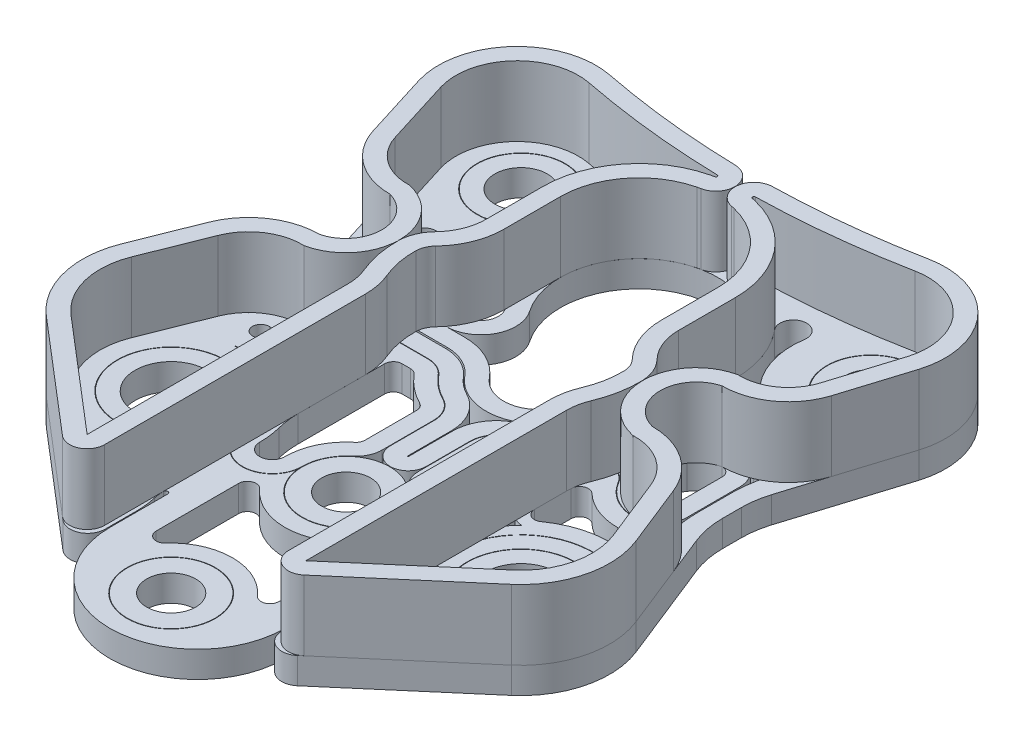
from build123d import *

# Parameters (mm, degrees)
BOSS_EXTRUDE1_START       = -3
BOSS_EXTRUDE1_OUTLINE_R   = 4.125000012
BOSS_EXTRUDE1_OUTLINE_R_2 = 2.799999992
BOSS_EXTRUDE1_OUTLINE_R_3 = 2.8
BOSS_EXTRUDE1_OUTLINE_R_4 = 4.124999994
BOSS_EXTRUDE1_OUTLINE_R_5 = 2.999999995
BOSS_EXTRUDE1_OUTLINE_R_6 = 3.000000008
BOSS_EXTRUDE1_DEPTH       = 3
EXTRUDE_THIN1_DEPTH       = 8
CUT_EXTRUDE_THIN1_START   = -3
SKETCH5_R                 = 5.049999995
SKETCH5_R_2               = 4.999999995
SKETCH5_R_3               = 5.050000008
SKETCH5_R_4               = 5.000000008
SKETCH5_R_5               = 5.050000041
SKETCH5_R_6               = 5.000000041
SKETCH5_R_7               = 6.175000012
SKETCH5_R_8               = 6.125000012
SKETCH5_R_9               = 6.174999994
SKETCH5_R_10              = 6.124999994
SKETCH5_R_11              = 5.049999983
SKETCH5_R_12              = 4.999999983
CUT_EXTRUDE_THIN1_DEPTH   = 3


# Read off the part's stored shape, not the designer's step: Boss-Extrude1
with BuildPart() as part:
    # Boss-Extrude1 outline → Boss-Extrude1 (new body)
    with BuildSketch(Plane(origin=(0, 0, 0), x_dir=(1, 0, 0), z_dir=(0, 1, 0)).offset(BOSS_EXTRUDE1_START)):
        with BuildLine():
            ThreePointArc((10.366684408, -31.537922105), (10.166894835, -32.677211872), (10.099999983, -33.831950857))
            Line((10.099999983, -33.831950857), (10.099999983, -37.450766092))
            ThreePointArc((10.099999983, -37.450766092), (11.263415045, -39.267390886), (13.400125624, -38.970527033))
            Line((13.400125624, -38.970527033), (26.581886043, -27.693789811))
            ThreePointArc((26.581886043, -27.693789811), (29.830051345, -22.426049379), (29.405725776, -16.251940949))
            Line((29.405725776, -16.251940949), (24.835394347, -4.782729295))
            ThreePointArc((24.835394347, -4.782729295), (24.304204333, -2.965609917), (24.12500005, -1.080942443))
            Line((24.12500005, -1.080942443), (24.12500005, 1.080943044))
            ThreePointArc((24.12500005, 1.080943044), (24.23905788, 2.586980033), (24.578629532, 4.058661959))
            Line((24.578629532, 4.058661959), (28.591733397, 16.924408361))
            ThreePointArc((28.591733397, 16.924408361), (26.651472545, 25.57149452), (18.240710019, 28.363587809))
            ThreePointArc((18.240710019, 28.363587809), (-9.2e-08, 26.5863268), (-18.240710204, 28.363587806))
            ThreePointArc((-18.240710204, 28.363587806), (-26.651472682, 25.571494548), (-28.591733597, 16.92440846))
            Line((-28.591733597, 16.92440846), (-24.578629568, 4.058661534))
            ThreePointArc((-24.578629568, 4.058661534), (-24.239057916, 2.586979607), (-24.125000086, 1.080942618))
            Line((-24.125000086, 1.080942618), (-24.125000086, -1.0809423))
            ThreePointArc((-24.125000086, -1.0809423), (-24.304204369, -2.965609774), (-24.835394384, -4.782729151))
            Line((-24.835394384, -4.782729151), (-29.405725836, -16.251940865))
            ThreePointArc((-29.405725836, -16.251940865), (-29.830051411, -22.42604931), (-26.581886114, -27.693789764))
            Line((-26.581886114, -27.693789764), (-13.400125663, -38.970526985))
            ThreePointArc((-13.400125663, -38.970526985), (-11.263415083, -39.267390839), (-10.100000021, -37.450766045))
            Line((-10.100000021, -37.450766045), (-10.100000021, -33.83195081))
            ThreePointArc((-10.100000021, -33.83195081), (-10.166894873, -32.677211824), (-10.366684446, -31.537922057))
            ThreePointArc((-10.366684446, -31.537922057), (-10.46759199, -30.95949776), (-10.499995417, -30.373232446))
            ThreePointArc((-10.499995417, -30.373232446), (-10.249556618, -30.124118114), (-10.000000021, -30.374116208))
            Line((-10.000000021, -30.374116208), (-10.000000021, -36.999999964))
            ThreePointArc((-10.000000021, -36.999999964), (-3.6e-08, -46.99999995), (9.99999995, -36.999999964))
            Line((9.99999995, -36.999999964), (9.99999995, -30.374999964))
            ThreePointArc((9.99999995, -30.374999964), (10.249116215, -30.125001526), (10.499993702, -30.373232505))
            ThreePointArc((10.499993702, -30.373232505), (10.467591952, -30.959497807), (10.366684408, -31.537922105))
        make_face()
        with BuildLine():
            Line((-12.500000027, -29.028587579), (-12.49998292, -30.366162352))
            ThreePointArc((-12.49998292, -30.366162352), (-12.454618123, -31.186933792), (-12.313347561, -31.996727808))
            ThreePointArc((-12.313347561, -31.996727808), (-12.153515903, -32.908159621), (-12.100000021, -33.83195081))
            Line((-12.100000021, -33.83195081), (-12.100000021, -37.450766045))
            Line((-12.100000021, -37.450766045), (-18.789338812, -31.728167974))
            ThreePointArc((-18.789338812, -31.728167974), (-19.103097358, -30.701738615), (-18.306532065, -29.982374043))
            ThreePointArc((-18.306532065, -29.982374043), (-16.09435347, -29.341389079), (-14.084269695, -28.217040787))
            ThreePointArc((-14.084269695, -28.217040787), (-13.044083394, -28.138577883), (-12.500000027, -29.028587579))
        make_face(mode=Mode.SUBTRACT)
        with Locations((-19.999999947, -20.000000079)):
            Circle(BOSS_EXTRUDE1_OUTLINE_R, mode=Mode.SUBTRACT)
        with BuildLine():
            Line((-11.800000029, -12.520592954), (-11.800000029, -15.023492615))
            ThreePointArc((-11.800000029, -15.023492615), (-11.799396788, -15.140252604), (-11.797587127, -15.257000126))
            ThreePointArc((-11.797587127, -15.257000126), (-12.499913264, -14.209980688), (-13.3350313, -13.265475752))
            ThreePointArc((-13.3350313, -13.265475752), (-12.495888638, -13.040641099), (-11.800000029, -12.520592954))
        make_face(mode=Mode.SUBTRACT)
        with BuildLine():
            ThreePointArc((-7.00000006, -20.000000014), (-8.43750006, -21.437500014), (-9.87500006, -20.000000014))
            ThreePointArc((-9.87500006, -20.000000014), (-9.953917866, -18.738311642), (-10.189441058, -17.496291354))
            ThreePointArc((-10.189441058, -17.496291354), (-10.422056562, -16.269604649), (-10.50000008, -15.023492674))
            Line((-10.50000008, -15.023492674), (-10.50000008, -5.100000013))
            ThreePointArc((-10.50000008, -5.100000013), (-10.207106861, -4.392893232), (-9.50000008, -4.100000013))
            Line((-9.50000008, -4.100000013), (-8.532291675, -4.100000013))
            ThreePointArc((-8.532291675, -4.100000013), (-8.107815311, -4.194560995), (-7.76361675, -4.460360381))
            ThreePointArc((-7.76361675, -4.460360381), (-6.307869008, -5.888015556), (-4.595045106, -6.994195952))
            ThreePointArc((-4.595045106, -6.994195952), (-4.197077158, -7.362673506), (-4.050000061, -7.884710404))
            Line((-4.050000061, -7.884710404), (-4.050000061, -13.795364615))
            ThreePointArc((-4.050000061, -13.795364615), (-4.146880469, -14.224753728), (-4.418750069, -14.570944058))
            ThreePointArc((-4.418750069, -14.570944058), (-6.321837217, -16.994276304), (-7.00000006, -20.000000014))
        make_face(mode=Mode.SUBTRACT)
        with Locations((-1.9e-08, -40.000000014)):
            Circle(BOSS_EXTRUDE1_OUTLINE_R_2, mode=Mode.SUBTRACT)
        with BuildLine():
            ThreePointArc((-5.250000011, -35.36993534), (-6.353553404, -35.64391187), (-7.000000019, -34.708497521))
            Line((-7.000000019, -34.708497521), (-7.000000019, -25.291502636))
            ThreePointArc((-7.000000019, -25.291502636), (-6.35355341, -24.356088289), (-5.250000019, -24.630064808))
            ThreePointArc((-5.250000019, -24.630064808), (-1.9e-08, -27.000000014), (5.249999981, -24.630064808))
            ThreePointArc((5.249999981, -24.630064808), (6.353553372, -24.356088289), (6.999999981, -25.291502636))
            Line((6.999999981, -25.291502636), (6.999999981, -34.708497521))
            ThreePointArc((6.999999981, -34.708497521), (6.353553366, -35.64391187), (5.249999973, -35.36993534))
            ThreePointArc((5.249999973, -35.36993534), (-1.9e-08, -33.0000001), (-5.250000011, -35.36993534))
        make_face(mode=Mode.SUBTRACT)
        with BuildLine():
            ThreePointArc((12.099999983, -33.831950857), (12.153515865, -32.908159669), (12.313347523, -31.996727855))
            ThreePointArc((12.313347523, -31.996727855), (12.454618084, -31.186933839), (12.499982882, -30.3661624))
            Line((12.499982882, -30.3661624), (12.499999988, -29.028587627))
            ThreePointArc((12.499999988, -29.028587627), (13.044083355, -28.13857793), (14.084269657, -28.217040834))
            ThreePointArc((14.084269657, -28.217040834), (16.094353431, -29.341389127), (18.306532027, -29.982374091))
            ThreePointArc((18.306532027, -29.982374091), (19.103097319, -30.701738663), (18.789338773, -31.728168021))
            Line((18.789338773, -31.728168021), (12.099999983, -37.450766092))
            Line((12.099999983, -37.450766092), (12.099999983, -33.831950857))
        make_face(mode=Mode.SUBTRACT)
        with Locations((0, -20.000000023)):
            Circle(BOSS_EXTRUDE1_OUTLINE_R_3, mode=Mode.SUBTRACT)
        with BuildLine():
            ThreePointArc((9.499999921, -4.099999975), (10.207106843, -4.392893112), (10.500000143, -5.099999967))
            Line((10.500000143, -5.099999967), (10.500000143, -15.023492628))
            ThreePointArc((10.500000143, -15.023492628), (10.422056621, -16.269604679), (10.189441095, -17.496291457))
            ThreePointArc((10.189441095, -17.496291457), (9.953917913, -18.738311703), (9.875000106, -20.000000032))
            ThreePointArc((9.875000106, -20.000000032), (8.437500055, -21.437500065), (7.000000022, -20.000000014))
            ThreePointArc((7.000000022, -20.000000014), (6.321837176, -16.994276299), (4.418750023, -14.570944051))
            ThreePointArc((4.418750023, -14.570944051), (4.146880421, -14.224753718), (4.050000013, -13.795364601))
            Line((4.050000013, -13.795364601), (4.050000013, -7.88471046))
            ThreePointArc((4.050000013, -7.88471046), (4.197077085, -7.362673564), (4.595045014, -6.994196002))
            ThreePointArc((4.595045014, -6.994196002), (6.307868914, -5.888015584), (7.763616651, -4.460360389))
            ThreePointArc((7.763616651, -4.460360389), (8.10781518, -4.194560993), (8.532291516, -4.099999975))
            Line((8.532291516, -4.099999975), (9.499999921, -4.099999975))
        make_face(mode=Mode.SUBTRACT)
        with BuildLine():
            Line((11.800000091, -15.023492674), (11.800000091, -12.520593014))
            ThreePointArc((11.800000091, -12.520593014), (12.495888699, -13.040641158), (13.335031361, -13.265475811))
            ThreePointArc((13.335031361, -13.265475811), (12.499913326, -14.209980747), (11.797587189, -15.257000186))
            ThreePointArc((11.797587189, -15.257000186), (11.799396849, -15.140252663), (11.800000091, -15.023492674))
        make_face(mode=Mode.SUBTRACT)
        with Locations((20.00000005, -20.000000079)):
            Circle(BOSS_EXTRUDE1_OUTLINE_R_4, mode=Mode.SUBTRACT)
        with BuildLine():
            ThreePointArc((-12.50000008, -10.971399629), (-13.044077752, -11.861419197), (-14.084269742, -11.782959215))
            ThreePointArc((-14.084269742, -11.782959215), (-17.244176451, -10.257255999), (-20.735075162, -9.901718511))
            ThreePointArc((-20.735075162, -9.901718511), (-21.757665264, -8.950859274), (-20.735075162, -8.000000038))
            Line((-20.735075162, -8.000000038), (-19.000000077, -8.000000038))
            ThreePointArc((-19.000000077, -8.000000038), (-16.409926191, -7.503192906), (-14.187500073, -6.083290721))
            ThreePointArc((-14.187500073, -6.083290721), (-13.104715368, -5.890916454), (-12.50000008, -6.809475106))
            Line((-12.50000008, -6.809475106), (-12.50000008, -10.971399629))
        make_face(mode=Mode.SUBTRACT)
        with BuildLine():
            Line((21.999999873, -3.000000013), (21.999999873, 3.000000012))
            ThreePointArc((21.999999873, 3.000000012), (21.121320259, 5.121320355), (18.99999995, 6.000000051))
            Line((18.99999995, 6.000000051), (20.570425502, 6.000000051))
            ThreePointArc((20.570425502, 6.000000051), (22.348071521, 6.583396407), (23.43433614, 8.106684252))
            Line((23.43433614, 8.106684252), (22.669354954, 5.654205029))
            ThreePointArc((22.669354954, 5.654205029), (22.261869098, 3.888186745), (22.124999815, 2.080942406))
            Line((22.124999815, 2.080942406), (22.124999815, -2.080942362))
            ThreePointArc((22.124999815, -2.080942362), (22.261869216, -3.8881868), (22.669355214, -5.654205161))
            Line((22.669355214, -5.654205161), (23.434336298, -8.106684057))
            ThreePointArc((23.434336298, -8.106684057), (22.561253849, -6.755762436), (21.115860751, -6.049999739))
            Line((21.115860751, -6.049999739), (18.999999597, -6.049999739))
            ThreePointArc((18.999999597, -6.049999739), (16.514516956, -5.396006561), (14.672792221, -3.603415968))
            ThreePointArc((14.672792221, -3.603415968), (13.578698307, -2.538510654), (12.102173951, -2.149999851))
            Line((12.102173951, -2.149999851), (8.532291319, -2.149999851))
            ThreePointArc((8.532291319, -2.149999851), (7.280086054, -2.428954742), (6.264700303, -3.213062919))
            ThreePointArc((6.264700303, -3.213062919), (5.090012795, -4.365081699), (3.707882645, -5.257692621))
            ThreePointArc((3.707882645, -5.257692621), (2.533877342, -6.344701531), (2.100000079, -7.884710409))
            Line((2.100000079, -7.884710409), (2.100000079, -13.795364585))
            ThreePointArc((2.100000079, -13.795364585), (2.385797275, -15.062062439), (3.187812582, -16.083323884))
            ThreePointArc((3.187812582, -16.083323884), (4.560754043, -17.831585028), (5.050000103, -20.000000019))
            ThreePointArc((5.050000103, -20.000000019), (8.437500057, -23.387499984), (11.825000025, -20.000000032))
            ThreePointArc((11.825000025, -20.000000032), (14.514181795, -13.938942129), (20.812504167, -11.865477201))
            ThreePointArc((20.812504167, -11.865477201), (20.834895662, -11.89283814), (20.807534723, -11.915229634))
            ThreePointArc((20.807534723, -11.915229634), (14.547734201, -13.976012819), (11.875000025, -20.000000032))
            ThreePointArc((11.875000025, -20.000000032), (8.437500057, -23.437499984), (5.000000103, -20.000000019))
            ThreePointArc((5.000000103, -20.000000019), (0, -14.99999992), (-5.000000103, -20.000000019))
            ThreePointArc((-5.000000103, -20.000000019), (-8.437500103, -23.43750001), (-11.875000103, -20.000000019))
            ThreePointArc((-11.875000103, -20.000000019), (-14.547734248, -13.976012803), (-20.807534758, -11.915229612))
            ThreePointArc((-20.807534758, -11.915229612), (-20.834895697, -11.892838118), (-20.812504202, -11.865477179))
            ThreePointArc((-20.812504202, -11.865477179), (-14.514181843, -13.938942113), (-11.825000103, -20.000000019))
            ThreePointArc((-11.825000103, -20.000000019), (-8.437500103, -23.38750001), (-5.050000103, -20.000000019))
            ThreePointArc((-5.050000103, -20.000000019), (-4.560754043, -17.831585028), (-3.187812582, -16.083323884))
            ThreePointArc((-3.187812582, -16.083323884), (-2.385797278, -15.062062431), (-2.100000084, -13.795364572))
            Line((-2.100000084, -13.795364572), (-2.100000084, -7.884710396))
            ThreePointArc((-2.100000084, -7.884710396), (-2.533877515, -6.344701559), (-3.707882945, -5.257692775))
            ThreePointArc((-3.707882945, -5.257692775), (-5.090013121, -4.365081919), (-6.26470067, -3.2130632))
            ThreePointArc((-6.26470067, -3.2130632), (-7.280086411, -2.42895501), (-8.532291672, -2.150000103))
            Line((-8.532291672, -2.150000103), (-12.102174341, -2.150000103))
            ThreePointArc((-12.102174341, -2.150000103), (-13.578698698, -2.538510906), (-14.672792612, -3.60341622))
            ThreePointArc((-14.672792612, -3.60341622), (-16.514517397, -5.396006848), (-19.000000102, -6.050000019))
            Line((-19.000000102, -6.050000019), (-21.115861256, -6.050000019))
            ThreePointArc((-21.115861256, -6.050000019), (-22.561254363, -6.755762697), (-23.434336829, -8.106684307))
            Line((-23.434336829, -8.106684307), (-22.669355612, -5.654205094))
            ThreePointArc((-22.669355612, -5.654205094), (-22.261869602, -3.888186778), (-22.125000181, -2.080942384))
            Line((-22.125000181, -2.080942384), (-22.125000181, 2.080942384))
            ThreePointArc((-22.125000181, 2.080942384), (-22.261869579, 3.88818678), (-22.669355568, 5.654205101))
            Line((-22.669355568, 5.654205101), (-23.434336754, 8.106684324))
            ThreePointArc((-23.434336754, 8.106684324), (-22.348071931, 6.58339629), (-20.570425601, 6.000000006))
            Line((-20.570425601, 6.000000006), (-19.00000004, 6.000000006))
            ThreePointArc((-19.00000004, 6.000000006), (-21.121320345, 5.121320333), (-21.999999982, 3.000000013))
            Line((-21.999999982, 3.000000013), (-21.999999982, -3.000000013))
            ThreePointArc((-21.999999982, -3.000000013), (-21.121320317, -5.121320376), (-18.999999953, -6.000000041))
            ThreePointArc((-18.999999953, -6.000000041), (-16.531447812, -5.348131817), (-14.706563884, -3.562500017))
            ThreePointArc((-14.706563884, -3.562500017), (-13.611633534, -2.491120942), (-12.130502206, -2.10000001))
            Line((-12.130502206, -2.10000001), (-8.532291669, -2.10000001))
            ThreePointArc((-8.532291669, -2.10000001), (-7.258862586, -2.38368295), (-6.226266907, -3.181081097))
            ThreePointArc((-6.226266907, -3.181081097), (-5.058786071, -4.326032277), (-3.685135246, -5.213167059))
            ThreePointArc((-3.685135246, -5.213167059), (-2.49123142, -6.31859972), (-2.050000134, -7.884710402))
            Line((-2.050000134, -7.884710402), (-2.050000134, -12.89999997))
            ThreePointArc((-2.050000134, -12.89999997), (-4.9e-08, -14.950000054), (2.050000035, -12.89999997))
            Line((2.050000035, -12.89999997), (2.050000035, -7.884710402))
            ThreePointArc((2.050000035, -7.884710402), (2.491231321, -6.31859972), (3.685135147, -5.213167059))
            ThreePointArc((3.685135147, -5.213167059), (5.058785972, -4.326032277), (6.226266808, -3.181081097))
            ThreePointArc((6.226266808, -3.181081097), (7.258862478, -2.383682962), (8.532291547, -2.100000023))
            Line((8.532291547, -2.100000023), (12.13050177, -2.100000023))
            ThreePointArc((12.13050177, -2.100000023), (13.611633064, -2.491120937), (14.706563409, -3.562499965))
            ThreePointArc((14.706563409, -3.562499965), (16.531447522, -5.348131816), (18.999999949, -5.999999936))
            ThreePointArc((18.999999949, -5.999999936), (21.121320239, -5.121320302), (21.999999873, -3.000000013))
        make_face(mode=Mode.SUBTRACT)
        with BuildLine():
            Line((8.566796286, 0.100000019), (12.130501728, 0.100000019))
            ThreePointArc((12.130501728, 0.100000019), (14.599053919, 0.751868227), (16.423937833, 2.537499986))
            ThreePointArc((16.423937833, 2.537499986), (17.518868376, 3.60887917), (18.999999946, 4.000000022))
            ThreePointArc((18.999999946, 4.000000022), (19.707106659, 3.70710679), (19.999999844, 3.000000057))
            Line((19.999999844, 3.000000057), (19.999999844, -3.000000013))
            ThreePointArc((19.999999844, -3.000000013), (19.707106656, -3.70710672), (18.999999949, -3.999999908))
            ThreePointArc((18.999999949, -3.999999908), (17.518868396, -3.608879064), (16.423937856, -2.537499904))
            ThreePointArc((16.423937856, -2.537499904), (14.599053947, -0.751868183), (12.130501783, -0.099999991))
            Line((12.130501783, -0.099999991), (8.532291616, -0.099999991))
            ThreePointArc((8.532291616, -0.099999991), (6.409909791, -0.572804904), (4.688916986, -1.901801842))
            ThreePointArc((4.688916986, -1.901801842), (3.809703006, -2.764049037), (2.775225204, -3.432138196))
            ThreePointArc((2.775225204, -3.432138196), (0.785385492, -5.274525956), (0.050000019, -7.884710422))
            Line((0.050000019, -7.884710422), (0.050000019, -12.899999966))
            ThreePointArc((0.050000019, -12.899999966), (-3.4e-08, -12.950000019), (-0.050000087, -12.899999966))
            Line((-0.050000087, -12.899999966), (-0.050000087, -7.884710422))
            ThreePointArc((-0.050000087, -7.884710422), (-0.785385575, -5.274525933), (-2.775225313, -3.432138162))
            ThreePointArc((-2.775225313, -3.432138162), (-3.809703095, -2.764049), (-4.688917057, -1.901801808))
            ThreePointArc((-4.688917057, -1.901801808), (-6.409909853, -0.572804904), (-8.532291653, -0.100000006))
            Line((-8.532291653, -0.100000006), (-12.130502211, -0.100000006))
            ThreePointArc((-12.130502211, -0.100000006), (-14.599054423, -0.751868227), (-16.423938341, -2.537500017))
            ThreePointArc((-16.423938341, -2.537500017), (-17.5188687, -3.6088791), (-19.000000039, -4.000000035))
            ThreePointArc((-19.000000039, -4.000000035), (-19.70710675, -3.70710681), (-19.999999975, -3.000000013))
            Line((-19.999999975, -3.000000013), (-19.999999975, 2.999999987))
            ThreePointArc((-19.999999975, 2.999999987), (-19.70710677, 3.707106768), (-19, 4))
            ThreePointArc((-19, 4), (-17.518868692, 3.608879058), (-16.423938353, 2.537499996))
            ThreePointArc((-16.423938353, 2.537499996), (-14.599054437, 0.75186822), (-12.130502235, 0.100000006))
            Line((-12.130502235, 0.100000006), (-8.566796426, 0.100000006))
            ThreePointArc((-8.566796426, 0.100000006), (-6.408303686, -0.389910295), (-4.672798077, -1.763636357))
            ThreePointArc((-4.672798077, -1.763636357), (-5.8e-08, -3.999999994), (4.67279796, -1.763636357))
            ThreePointArc((4.67279796, -1.763636357), (6.408303557, -0.389910293), (8.566796286, 0.100000019))
        make_face(mode=Mode.SUBTRACT)
        with BuildLine():
            ThreePointArc((-11.096097269, 21.311684072), (-9.184986877, 22.990779132), (-8.43497969, 20.559896089))
            ThreePointArc((-8.43497969, 20.559896089), (-10.988510456, 14.001996274), (-9.044328648, 7.238363637))
            ThreePointArc((-9.044328648, 7.238363637), (-8.917209306, 5.171756308), (-10.68875203, 4.100000013))
            Line((-10.68875203, 4.100000013), (-11.58447578, 4.100000013))
            ThreePointArc((-11.58447578, 4.100000013), (-12.515425114, 4.329877605), (-13.232370056, 4.966666675))
            ThreePointArc((-13.232370056, 4.966666675), (-15.741677392, 7.195428442), (-19.000000108, 8.000000003))
            Line((-19.000000108, 8.000000003), (-20.570425657, 8.000000003))
            ThreePointArc((-20.570425657, 8.000000003), (-22.178350476, 9.509047598), (-20.570425657, 11.018095192))
            ThreePointArc((-20.570425657, 11.018095192), (-13.377975934, 13.905018789), (-11.096097269, 21.311684072))
        make_face(mode=Mode.SUBTRACT)
        with Locations((-19.999999947, 19.999999965)):
            Circle(BOSS_EXTRUDE1_OUTLINE_R_5, mode=Mode.SUBTRACT)
        with BuildLine():
            ThreePointArc((14.084269761, -11.782959248), (13.044077764, -11.861419222), (12.500000109, -10.971399636))
            Line((12.500000109, -10.971399636), (12.500000109, -6.809475206))
            ThreePointArc((12.500000109, -6.809475206), (13.104715364, -5.890916569), (14.18750005, -6.083290774))
            ThreePointArc((14.18750005, -6.083290774), (16.409926011, -7.503192694), (18.999999637, -7.999999728))
            Line((18.999999637, -7.999999728), (20.735074722, -7.999999728))
            ThreePointArc((20.735074722, -7.999999728), (21.757664961, -8.950859132), (20.735074722, -9.901718537))
            ThreePointArc((20.735074722, -9.901718537), (17.244176251, -10.257256109), (14.084269761, -11.782959248))
        make_face(mode=Mode.SUBTRACT)
        with BuildLine():
            ThreePointArc((-7.399905219, 8.376727248), (0, 22.499363557), (7.399905219, 8.376727248))
            ThreePointArc((7.399905219, 8.376727248), (7.145666534, 4.24351259), (10.688751983, 2.1))
            Line((10.688751983, 2.1), (8.566796367, 2.1))
            ThreePointArc((8.566796367, 2.1), (5.544906531, 1.414125578), (3.115198679, -0.509090909))
            ThreePointArc((3.115198679, -0.509090909), (0, -2), (-3.115198679, -0.509090909))
            ThreePointArc((-3.115198679, -0.509090909), (-5.544906531, 1.414125578), (-8.566796367, 2.1))
            Line((-8.566796367, 2.1), (-10.688751983, 2.1))
            ThreePointArc((-10.688751983, 2.1), (-7.145666534, 4.24351259), (-7.399905219, 8.376727248))
        make_face(mode=Mode.SUBTRACT)
        with BuildLine():
            ThreePointArc((10.68875193, 4.100000064), (8.917209198, 5.171756347), (9.044328526, 7.238363677))
            ThreePointArc((9.044328526, 7.238363677), (10.988510304, 14.001996325), (8.434979507, 20.559896129))
            ThreePointArc((8.434979507, 20.559896129), (9.184986695, 22.990779171), (11.096097086, 21.311684112))
            ThreePointArc((11.096097086, 21.311684112), (13.37797564, 13.90501895), (20.570425146, 11.018095211))
            ThreePointArc((20.570425146, 11.018095211), (22.178350001, 9.509047527), (20.570425146, 7.999999842))
            Line((20.570425146, 7.999999842), (18.999999605, 7.999999842))
            ThreePointArc((18.999999605, 7.999999842), (15.741677033, 7.195428317), (13.232369774, 4.966666688))
            ThreePointArc((13.232369774, 4.966666688), (12.515424837, 4.329877646), (11.584475524, 4.100000064))
            Line((11.584475524, 4.100000064), (10.68875193, 4.100000064))
        make_face(mode=Mode.SUBTRACT)
        with Locations((19.999999882, 20.000000078)):
            Circle(BOSS_EXTRUDE1_OUTLINE_R_6, mode=Mode.SUBTRACT)
    extrude(amount=BOSS_EXTRUDE1_DEPTH)

    # Sketch5 → Cut-Extrude-Thin1 (cut)
    # profile 1 of 6: a face of its own
    with BuildSketch(Plane(origin=(0, 0, 0), x_dir=(1, 0, 0), z_dir=(0, 1, 0)).offset(CUT_EXTRUDE_THIN1_START)):
        with Locations((-19.999999947, 19.999999965)):
            Circle(SKETCH5_R)
        with Locations((-19.999999947, 19.999999965)):
            Circle(SKETCH5_R_2, mode=Mode.SUBTRACT)
    # profile 2 of 6: a face of its own
    with BuildSketch(Plane(origin=(0, 0, 0), x_dir=(1, 0, 0), z_dir=(0, 1, 0)).offset(CUT_EXTRUDE_THIN1_START)):
        with Locations((19.999999882, 20.000000078)):
            Circle(SKETCH5_R_3)
        with Locations((19.999999882, 20.000000078)):
            Circle(SKETCH5_R_4, mode=Mode.SUBTRACT)
    # profile 3 of 6: a face of its own
    with BuildSketch(Plane(origin=(0, 0, 0), x_dir=(1, 0, 0), z_dir=(0, 1, 0)).offset(CUT_EXTRUDE_THIN1_START)):
        with Locations((1.9e-08, -20.000000001)):
            Circle(SKETCH5_R_5)
        with Locations((1.9e-08, -20.000000001)):
            Circle(SKETCH5_R_6, mode=Mode.SUBTRACT)
    # profile 4 of 6: a face of its own
    with BuildSketch(Plane(origin=(0, 0, 0), x_dir=(1, 0, 0), z_dir=(0, 1, 0)).offset(CUT_EXTRUDE_THIN1_START)):
        with Locations((-19.999999947, -20.000000079)):
            Circle(SKETCH5_R_7)
        with Locations((-19.999999947, -20.000000079)):
            Circle(SKETCH5_R_8, mode=Mode.SUBTRACT)
    # profile 5 of 6: a face of its own
    with BuildSketch(Plane(origin=(0, 0, 0), x_dir=(1, 0, 0), z_dir=(0, 1, 0)).offset(CUT_EXTRUDE_THIN1_START)):
        with Locations((20.00000005, -20.000000079)):
            Circle(SKETCH5_R_9)
        with Locations((20.00000005, -20.000000079)):
            Circle(SKETCH5_R_10, mode=Mode.SUBTRACT)
    # profile 6 of 6: a face of its own
    with BuildSketch(Plane(origin=(0, 0, 0), x_dir=(1, 0, 0), z_dir=(0, 1, 0)).offset(CUT_EXTRUDE_THIN1_START)):
        with Locations((1.9e-08, -40.000000001)):
            Circle(SKETCH5_R_11)
        with Locations((1.9e-08, -40.000000001)):
            Circle(SKETCH5_R_12, mode=Mode.SUBTRACT)
    extrude(amount=CUT_EXTRUDE_THIN1_DEPTH, mode=Mode.SUBTRACT)


with BuildPart() as body_2:
    # Sketch4 → Extrude-Thin1 (new body)
    with BuildSketch(Plane(origin=(0, 0, 0), x_dir=(1, 0, 0), z_dir=(0, 1, 0))):
        with BuildLine():
            ThreePointArc((-1.750855432, 22.327415735), (-0.020807022, 24.637091431), (-2.12658043, 26.610258346))
            ThreePointArc((-2.12658043, 26.610258346), (-10.221309695, 27.140764569), (-18.240710153, 28.363587138))
            ThreePointArc((-18.240710153, 28.363587138), (-26.651472631, 25.57149388), (-28.591733546, 16.924407792))
            Line((-28.591733546, 16.924407792), (-26.201319782, 9.260899373))
            ThreePointArc((-26.201319782, 9.260899373), (-23.45914983, 5.455315904), (-19, 4))
            ThreePointArc((-19, 4), (-15.91521058, 1e-09), (-18.999999953, -4.000000035))
            ThreePointArc((-18.999999953, -4.000000035), (-23.58714955, -5.414110034), (-26.581886075, -9.165536651))
            Line((-26.581886075, -9.165536651), (-29.405725798, -16.251940853))
            ThreePointArc((-29.405725798, -16.251940853), (-29.830051368, -22.426049297), (-26.581886075, -27.693789751))
            Line((-26.581886075, -27.693789751), (-13.801498018, -38.627160771))
            ThreePointArc((-13.801498018, -38.627160771), (-11.664787438, -38.924024625), (-10.501372376, -37.107399831))
            Line((-10.501372376, -37.107399831), (-10.501372376, -7.285892114))
            ThreePointArc((-10.501372376, -7.285892114), (-10.658658616, -5.707335535), (-11.124332595, -4.190850263))
            ThreePointArc((-11.124332595, -4.190850263), (-11.724572006, -2.202837397), (-11.901259261, -0.133715815))
            ThreePointArc((-11.901259261, -0.133715815), (-11.720114064, 0.734766996), (-11.23450326, 1.477234586))
            ThreePointArc((-11.23450326, 1.477234586), (-9.579592228, 4.033683441), (-8.999957149, 7.023363097))
            Line((-8.999957149, 7.023363097), (-8.999957149, 13.49922637))
            ThreePointArc((-8.999957149, 13.49922637), (-7.075952176, 19.060644077), (-2.12658043, 22.24417692))
            ThreePointArc((-2.12658043, 22.24417692), (-1.939144668, 22.287722541), (-1.750855432, 22.327415735))
        make_face()
        with BuildLine():
            ThreePointArc((-2.143321153, 24.288530382), (-2.01315497, 24.462306832), (-2.171590125, 24.610764878))
            ThreePointArc((-2.171590125, 24.610764878), (-10.437646699, 25.152499421), (-18.626780108, 26.401203386))
            ThreePointArc((-18.626780108, 26.401203386), (-25.165870318, 24.232462413), (-26.679829477, 17.51152008))
            Line((-26.679829477, 17.51152008), (-24.294152089, 9.863196168))
            ThreePointArc((-24.294152089, 9.863196168), (-22.190120102, 7.006422975), (-18.786674586, 6.004094541))
            ThreePointArc((-18.786674586, 6.004094541), (-13.915210634, 0.000815341), (-18.785078896, -6.003758357))
            ThreePointArc((-18.785078896, -6.003758357), (-22.373472476, -7.008382312), (-24.722168246, -9.901385244))
            Line((-24.722168246, -9.901385244), (-27.547804713, -16.992298364))
            ThreePointArc((-27.547804713, -16.992298364), (-27.888312807, -21.946829766), (-25.281760423, -26.17402882))
            Line((-25.281760423, -26.17402882), (-12.501372376, -37.107399831))
            Line((-12.501372376, -37.107399831), (-12.501372376, -7.285892114))
            ThreePointArc((-12.501372376, -7.285892114), (-12.619337056, -6.101974679), (-12.96859254, -4.964610725))
            ThreePointArc((-12.96859254, -4.964610725), (-13.688879834, -2.578995286), (-13.90090454, -0.096049388))
            ThreePointArc((-13.90090454, -0.096049388), (-13.568084566, 1.499623208), (-12.675866732, 2.863766714))
            ThreePointArc((-12.675866732, 2.863766714), (-11.434683458, 4.781103355), (-10.999957149, 7.023363097))
            Line((-10.999957149, 7.023363097), (-10.999957149, 13.49922637))
            ThreePointArc((-10.999957149, 13.49922637), (-8.648384065, 20.296547776), (-2.599122476, 24.187551309))
            ThreePointArc((-2.599122476, 24.187551309), (-2.3717395, 24.240377582), (-2.143321153, 24.288530382))
        make_face(mode=Mode.SUBTRACT)
    extrude(amount=EXTRUDE_THIN1_DEPTH)


with BuildPart() as body_3:
    # Mirror1: mirrored copy
    add(body_2.part.mirror(Plane(origin=(0, 0, 0), x_dir=(0, 0, 1), z_dir=(1, 0, 0))))


with BuildPart() as cut_extrude_thin1_piece_1:
    # of the separate pieces the step leaves, piece 1, a body of its own (cut_extrude_thin1_pieces)
    add(part.part.solids().sort_by_distance((10.499993702, -3, 30.373232505))[0])


with BuildPart() as cut_extrude_thin1_piece_2:
    # of the separate pieces the step leaves, piece 2, a body of its own (cut_extrude_thin1_pieces)
    add(part.part.solids().sort_by_distance((-13.874999935, -3, 20.000000079))[0])


with BuildPart() as cut_extrude_thin1_piece_3:
    # of the separate pieces the step leaves, piece 3, a body of its own (cut_extrude_thin1_pieces)
    add(part.part.solids().sort_by_distance((26.125000044, -3, 20.000000079))[0])


with BuildPart() as cut_extrude_thin1_piece_4:
    # of the separate pieces the step leaves, piece 4, a body of its own (cut_extrude_thin1_pieces)
    add(part.part.solids().sort_by_distance((5.000000082, -3, 20.00000001))[0])


with BuildPart() as cut_extrude_thin1_piece_5:
    # of the separate pieces the step leaves, piece 5, a body of its own (cut_extrude_thin1_pieces)
    add(part.part.solids().sort_by_distance((5.000000002, -3, 40.000000001))[0])


with BuildPart() as cut_extrude_thin1_piece_6:
    # of the separate pieces the step leaves, piece 6, a body of its own (cut_extrude_thin1_pieces)
    add(part.part.solids().sort_by_distance((24.99999989, -3, -20.000000078))[0])


with BuildPart() as cut_extrude_thin1_piece_7:
    # of the separate pieces the step leaves, piece 7, a body of its own (cut_extrude_thin1_pieces)
    add(part.part.solids().sort_by_distance((-14.999999952, -3, -19.999999965))[0])


solid = Compound([body_2.part, body_3.part, cut_extrude_thin1_piece_1.part, cut_extrude_thin1_piece_2.part, cut_extrude_thin1_piece_3.part, cut_extrude_thin1_piece_4.part, cut_extrude_thin1_piece_5.part, cut_extrude_thin1_piece_6.part, cut_extrude_thin1_piece_7.part])
